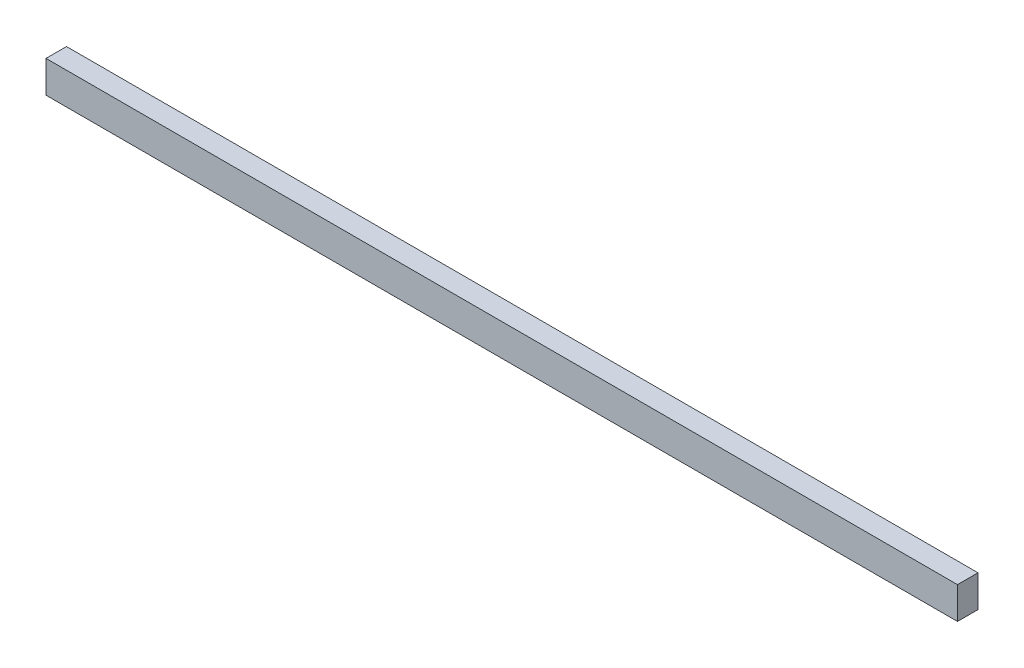
from build123d import *

# Parameters (mm, degrees)
SKETCH1_W           = 45
SKETCH1_H           = 70
BOSS_EXTRUDE1_DEPTH = 2000


with BuildPart() as part:
    # Sketch1 → Boss-Extrude1 (new body)
    with BuildSketch(Plane(origin=(0, 0, 0), x_dir=(0, 0, -1), z_dir=(1, 0, 0))):
        with Locations((22.5, -35)):
            Rectangle(SKETCH1_W, SKETCH1_H)
    extrude(amount=BOSS_EXTRUDE1_DEPTH)


solid = part.part
